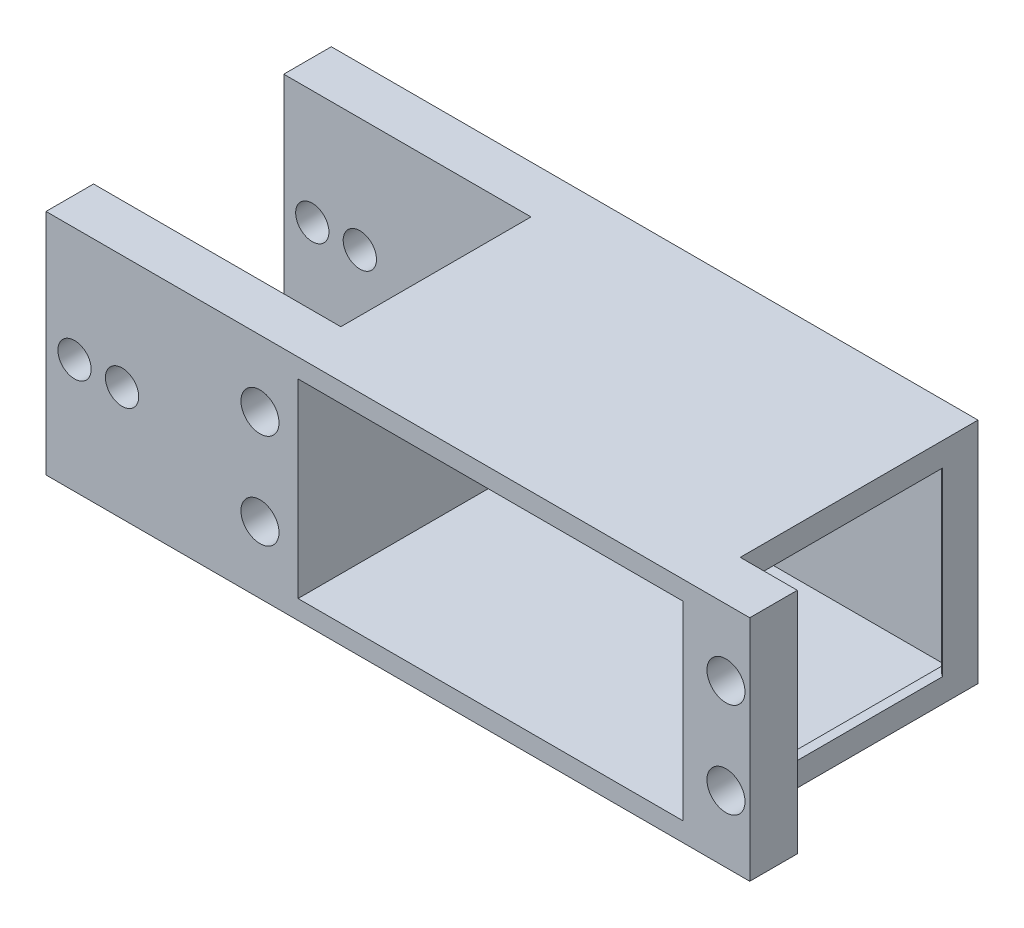
from build123d import *

# Parameters (mm, degrees)
SKETCH1_W                 = 56
SKETCH1_H                 = 24
BOSS_EXTRUDE1_DEPTH       = 30
SHELL1_T                  = -2
SHELL1_THICKNESS_2_FACE_W = 28
SHELL1_THICKNESS_2_FACE_H = 20
SHELL1_THICKNESS_2_DEPTH  = 6.5
SHELL1_THICKNESS_3_FACE_W = 28
SHELL1_THICKNESS_3_FACE_H = 20
SHELL1_THICKNESS_3_DEPTH  = 5
SKETCH12_W                = 20
SKETCH12_H                = 19
CUT_EXTRUDE1_DEPTH        = 10
FILLET1_R                 = 2
SKETCH13_W                = 2
SKETCH13_H                = 24
CUT_EXTRUDE2_DEPTH        = 43.755116653
SKETCH17_W                = 25
SKETCH17_H                = 24
CUT_EXTRUDE4_DEPTH        = 4
SKETCH19_R                = 2
CUT_EXTRUDE5_DEPTH        = 13
CUT_EXTRUDE7_DEPTH        = 2
SKETCH21_W                = 25
SKETCH21_H                = 24
CUT_EXTRUDE8_DEPTH        = 6
SKETCH26_W                = 5
SKETCH26_H                = 24
BOSS_EXTRUDE3_DEPTH       = 20
SKETCH27_W                = 5
SKETCH27_H                = 24
BOSS_EXTRUDE4_DEPTH       = 26
SKETCH28_R                = 1.75
CUT_EXTRUDE9_DEPTH        = 57.21387729


with BuildPart() as part:
    # Sketch1 → Boss-Extrude1 (new body)
    with BuildSketch(Plane.XY):
        Rectangle(SKETCH1_W, SKETCH1_H)
    extrude(amount=BOSS_EXTRUDE1_DEPTH)

    # Shell1
    shell1_openings = [part.faces().sort_by_distance(p)[0] for p in [
        (0, 0, 30),
    ]]
    offset(amount=SHELL1_T, openings=shell1_openings, kind=Kind.INTERSECTION)

    # Shell1 thickness 2 face (on inner face of the shell) → Shell1 thickness 2 (add)
    with BuildSketch(Plane(origin=(-26, 0, 16), x_dir=(0, 0, -1), z_dir=(-1, 0, 0))):
        Rectangle(SHELL1_THICKNESS_2_FACE_W, SHELL1_THICKNESS_2_FACE_H)
    extrude(amount=-SHELL1_THICKNESS_2_DEPTH)

    # Shell1 thickness 3 face (on inner face of the shell) → Shell1 thickness 3 (add)
    with BuildSketch(Plane(origin=(26, 0, 16), x_dir=(0, 0, 1), z_dir=(1, 0, 0))):
        Rectangle(SHELL1_THICKNESS_3_FACE_W, SHELL1_THICKNESS_3_FACE_H)
    extrude(amount=-SHELL1_THICKNESS_3_DEPTH)

    # Sketch12 → Cut-Extrude1 (cut)
    with BuildSketch(Plane(origin=(28, 0, 0), x_dir=(0, 0, -1), z_dir=(1, 0, 0))):
        with Locations((-14, 0)):
            Rectangle(SKETCH12_W, SKETCH12_H)
    extrude(amount=-CUT_EXTRUDE1_DEPTH, mode=Mode.SUBTRACT)

    # Fillet1
    fillet1_edges = [part.edges().sort_by_distance(p)[0] for p in [
        (21, 0, 4),
    ]]
    fillet(fillet1_edges, radius=FILLET1_R - 0.0001)  # a hair under: the kernel refuses the full size

    # Sketch13 → Cut-Extrude2 (cut, through all)
    with BuildSketch(Plane.XY.offset(30)):
        with Locations((-27, 0)):
            Rectangle(SKETCH13_W, SKETCH13_H)
    extrude(amount=-CUT_EXTRUDE2_DEPTH, mode=Mode.SUBTRACT)

    # Sketch17 → Cut-Extrude4 (cut)
    with BuildSketch(Plane(origin=(28, 0, 0), x_dir=(0, 0, -1), z_dir=(1, 0, 0))):
        with Locations((-12.5, 0)):
            Rectangle(SKETCH17_W, SKETCH17_H)
    extrude(amount=-CUT_EXTRUDE4_DEPTH, mode=Mode.SUBTRACT)

    # Sketch19 → Cut-Extrude5 (cut)
    with BuildSketch(Plane.XY.offset(30)):
        with Locations((-23.5, -5)):
            Circle(SKETCH19_R)
        with Locations((-23.5, 5)):
            Circle(SKETCH19_R)
        with Locations((25.5, 5)):
            Circle(SKETCH19_R)
        with Locations((25.5, -5)):
            Circle(SKETCH19_R)
    extrude(amount=-CUT_EXTRUDE5_DEPTH, mode=Mode.SUBTRACT)

    # Sketch20 → Cut-Extrude7 (cut)
    with BuildSketch(Plane(origin=(24, 0, 0), x_dir=(0, 0, -1), z_dir=(1, 0, 0))):
        Polygon((-25, 6.322875656), (-25, 12), (0, 12), (0, -12), (-25, -12), (-25, -6.322875656), align=None)
        Polygon((-24, -6.322875656), (-24, -9.5), (-4, -9.5), (-4, 9.5), (-24, 9.5), (-24, 6.322875656), align=None, mode=Mode.SUBTRACT)
    extrude(amount=-CUT_EXTRUDE7_DEPTH, mode=Mode.SUBTRACT)

    # Sketch21 → Cut-Extrude8 (cut)
    with BuildSketch(Plane.ZY.offset(26)):
        with Locations((12.5, 0)):
            Rectangle(SKETCH21_W, SKETCH21_H)
    extrude(amount=-CUT_EXTRUDE8_DEPTH, mode=Mode.SUBTRACT)

    # Sketch26 → Boss-Extrude3 (add)
    with BuildSketch(Plane.ZY.offset(26)):
        with Locations((27.5, 0)):
            Rectangle(SKETCH26_W, SKETCH26_H)
    extrude(amount=BOSS_EXTRUDE3_DEPTH)

    # Sketch27 → Boss-Extrude4 (add)
    with BuildSketch(Plane.ZY.offset(20)):
        with Locations((2.5, 0)):
            Rectangle(SKETCH27_W, SKETCH27_H)
    extrude(amount=BOSS_EXTRUDE4_DEPTH)

    # Sketch28 → Cut-Extrude9 (cut, through all)
    with BuildSketch(Plane.XY.offset(30)):
        with Locations((-43, 0)):
            Circle(SKETCH28_R)
        with Locations((-38, 0)):
            Circle(SKETCH28_R)
    extrude(amount=-CUT_EXTRUDE9_DEPTH, mode=Mode.SUBTRACT)


solid = part.part
